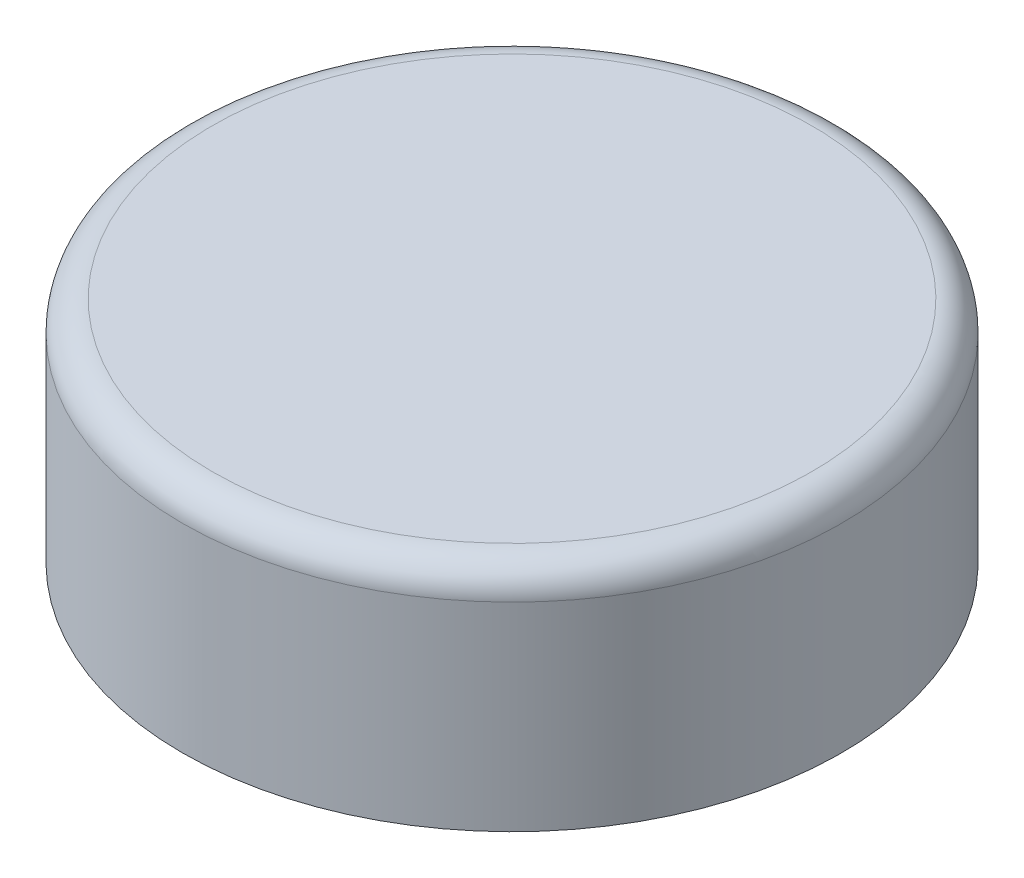
from build123d import *

# Parameters (mm, degrees)
SKETCH1_R           = 33.15
BOSS_EXTRUDE1_DEPTH = 23
SHELL1_T            = -3
BOSS_EXTRUDE2_START = 10
BOSS_EXTRUDE2_DEPTH = 10
CUT_EXTRUDE1_DEPTH  = 20


with BuildPart() as part:
    # Sketch1 → Boss-Extrude1 (new body)
    with BuildSketch(Plane(origin=(0, 0, 0), x_dir=(1, 0, 0), z_dir=(0, 1, 0))):
        with Locations(Location((0, 0, 0), (0, 0, 270))):
            Circle(SKETCH1_R)
    extrude(amount=BOSS_EXTRUDE1_DEPTH)

    # Shell1
    shell1_openings = [part.faces().sort_by_distance(p)[0] for p in [
        (0, 0, 0),
    ]]
    offset(amount=SHELL1_T, openings=shell1_openings, kind=Kind.INTERSECTION)

    # Sketch2 → Boss-Extrude2 (add)
    with BuildSketch(Plane.XZ.offset(-20).offset(BOSS_EXTRUDE2_START)):
        with BuildLine():
            Line((-5.5, -29.64409722), (-5.5, -10.25))
            Line((-5.5, -10.25), (-22.75, -10.25))
            Line((-22.75, -10.25), (-22.75, 10.25))
            Line((-22.75, 10.25), (22.75, 10.25))
            Line((22.75, 10.25), (22.75, -10.25))
            Line((22.75, -10.25), (5.5, -10.25))
            Line((5.5, -10.25), (5.5, -29.64409722))
            ThreePointArc((5.5, -29.64409722), (23.182401731, -19.276896794), (30.15, 0))
            ThreePointArc((30.15, 0), (-19.276896794, 23.182401731), (-5.5, -29.64409722))
        make_face()
    extrude(amount=-BOSS_EXTRUDE2_DEPTH)

    # Sketch3 → Cut-Extrude1 (cut)
    with BuildSketch(Plane.XZ):
        with BuildLine():
            Line((-5.5, -29.64409722), (-5.5, -32.69055674))
            ThreePointArc((-5.5, -32.69055674), (0, -33.15), (5.5, -32.69055674))
            Line((5.5, -32.69055674), (5.5, -29.64409722))
            ThreePointArc((5.5, -29.64409722), (0, -30.15), (-5.5, -29.64409722))
        make_face()
    extrude(amount=-CUT_EXTRUDE1_DEPTH, mode=Mode.SUBTRACT)

    # Fillet1: read off the stored shape, not the designer's step
    # Fillet1 outline → Fillet1 (revolve, cut)
    with BuildSketch(Plane.XY):
        with BuildLine():
            ThreePointArc((30.15, 23), (32.271320344, 22.121320344), (33.15, 20))
            Line((33.15, 20), (33.15, 23))
            Line((33.15, 23), (30.15, 23))
        make_face()
    revolve(axis=Axis((0, 0, 0), (0, 1, 0)), mode=Mode.SUBTRACT)


solid = part.part
